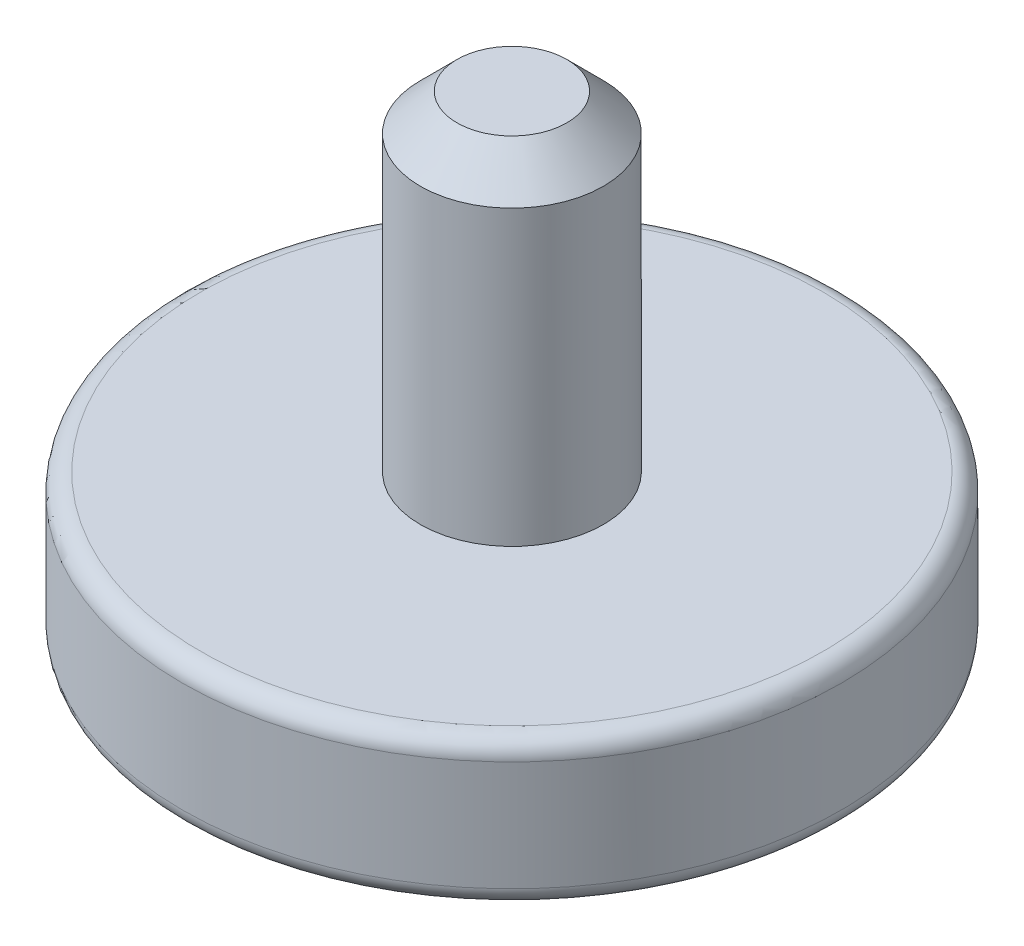
from build123d import *

# Parameters (mm, degrees)
FILLET4_R     = 0.5
CHAMFER1_SIZE = 1
FILLET6_R     = 0.75


with BuildPart() as part:
    # Sketch1 → Revolve1 (revolve)
    with BuildSketch(Plane.XY, mode=Mode.PRIVATE) as revolve1_sk:
        Polygon((0, 0), (1.75, 0), (1.75, 1.5), (1.25, 1.5), (1.25, 4.5), (9, 4.5), (9, 8.5), (2.5, 8.5), (2.5, 17.5), (0, 17.5), align=None)
    revolve(revolve1_sk.sketch.rotate(Axis((0, 8.13, 0), (0, -1, 0)), 90), axis=Axis((0, 8.13, 0), (0, -1, 0)))

    # Fillet4
    fillet4_edges = [part.edges().sort_by_distance(p)[0] for p in [
        (0, 8.5, -9),
        (0, 4.5, -9),
    ]]
    fillet(fillet4_edges, radius=FILLET4_R)

    # Chamfer1
    chamfer1_edges = [part.edges().sort_by_distance(p)[0] for p in [
        (0, 17.5, -2.5),
    ]]
    chamfer(chamfer1_edges, length=CHAMFER1_SIZE)

    # Fillet6
    # the kernel refuses this fillet: 0.75 mm, written as the material it takes off along each edge
    with BuildSketch(Plane(origin=(0, 1.5, 0), x_dir=(0, 0, 1), z_dir=(1, 0, 0))) as fillet6_piece_1:
        with BuildLine():
            CenterArc((1, 0.707106781), FILLET6_R, 289.471220634, 70.528779366)
            Line((1.75, 0.707106781), (1.765, 0.707106781))
            Line((1.765, 0.707106781), (1.765, 0))
            Line((1.765, 0), (1.75, -0.015))
            ThreePointArc((1.75, -0.015), (1.5, -0.015), (1.255, -0.014142136))
            Line((1.255, -0.014142136), (1.25, 0))
        make_face()
    revolve(axis=Axis((0, 1.5, 0), (0, -1, 0)), mode=Mode.SUBTRACT)
    with BuildSketch(Plane(origin=(0, 0, 0), x_dir=(0, 0, 1), z_dir=(1, 0, 0))) as fillet6_piece_2:
        with BuildLine():
            CenterArc((1.75 - FILLET6_R, -FILLET6_R), FILLET6_R, 0, 90)
            Line((1.75 - FILLET6_R, 0), (1.75 - FILLET6_R, FILLET6_R * 0.02))
            Line((1.75 - FILLET6_R, FILLET6_R * 0.02), (1.75 + FILLET6_R * 0.02, FILLET6_R * 0.02))
            Line((1.75 + FILLET6_R * 0.02, FILLET6_R * 0.02), (1.75 + FILLET6_R * 0.02, -FILLET6_R))
            Line((1.75 + FILLET6_R * 0.02, -FILLET6_R), (1.75, -FILLET6_R))
        make_face()
    revolve(axis=Axis((0, 0, 0), (0, -1, 0)), mode=Mode.SUBTRACT)


solid = part.part
